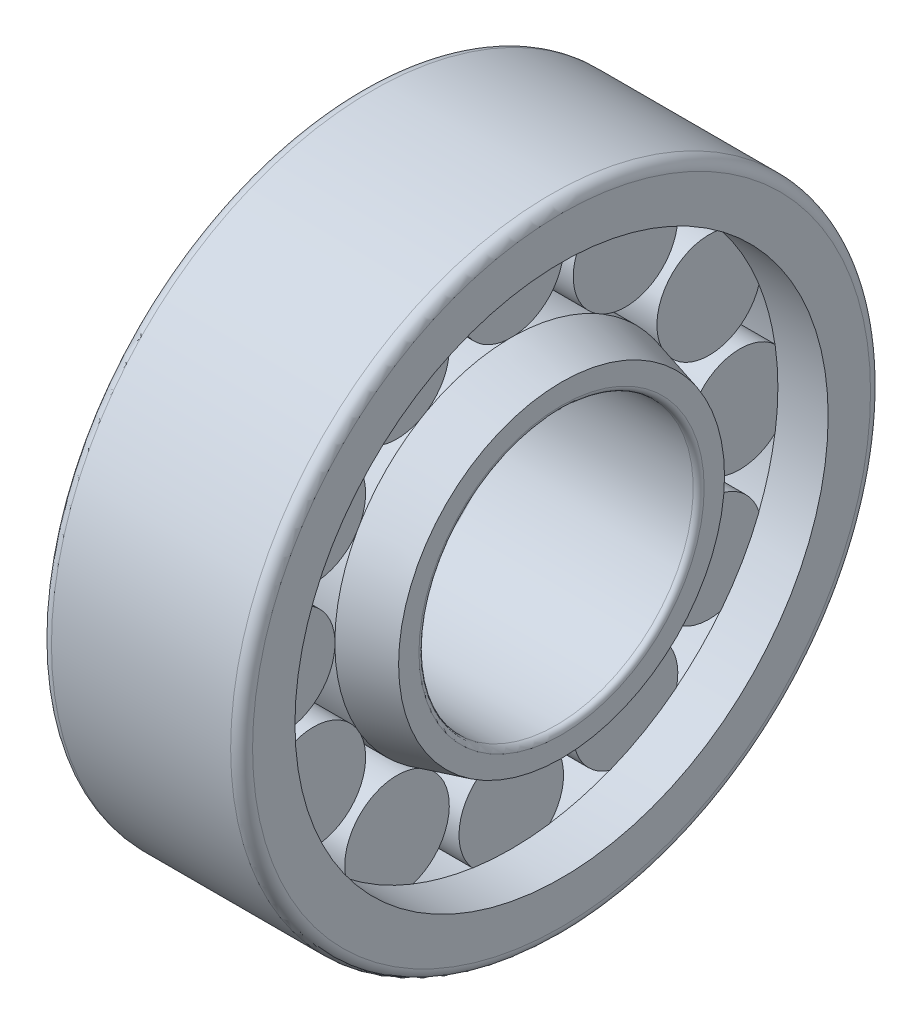
from build123d import *

# Parameters (mm, degrees)
SKETCH2_W               = 5.5
SKETCH2_H               = 2.86
CIRCULAR_PATTERN1_COUNT = 12
FILLET1_R               = 0.6
FILLET2_R               = 0.3


with BuildPart() as part:
    # Sketch1 → Revolve1 (revolve)
    with BuildSketch(Plane.XY):
        Polygon((-5.5, 7.5), (5.5, 7.5), (5.5, 8.913139721), (2.75, 9.65), (-2.75, 9.65), (-5.5, 8.913139721), align=None)
    revolve(axis=Axis((-10.137871204, 0, 0), (1, 0, 0)))

    # Sketch2 → Revolve2 (revolve)
    with BuildSketch(Plane.XY):
        with Locations((0, 11.07)):
            Rectangle(SKETCH2_W, SKETCH2_H)
    revolve2 = revolve(axis=Axis((-7.422783257, 12.5, 0), (1, 0, 0)))

    # Sketch3 → Revolve3 (revolve)
    with BuildSketch(Plane.XY):
        Polygon((-5.5, 17.5), (5.5, 17.5), (5.5, 14.5825), (2.74, 14.5825), (2.74, 15.35), (-2.74, 15.35), (-2.74, 14.5825), (-5.5, 14.5825), align=None)
    revolve(axis=Axis((-9.082213196, 0, 0), (1, 0, 0)))

    # Circular-Pattern1: Revolve2 ×12 about axis
    circular_pattern1_axis = Axis((-10.137871204, 0, 0), (1, 0, 0))
    for i in range(1, CIRCULAR_PATTERN1_COUNT):
        add(revolve2.rotate(circular_pattern1_axis, i * 360 / CIRCULAR_PATTERN1_COUNT))

    # Fillet1
    fillet1_edges = [part.edges().sort_by_distance(p)[0] for p in [
        (-5.5, -17.5, 0),
        (5.5, -17.5, 0),
    ]]
    fillet(fillet1_edges, radius=FILLET1_R)

    # Fillet2
    fillet2_edges = [part.edges().sort_by_distance(p)[0] for p in [
        (5.5, -7.5, 0),
        (-5.5, -7.5, 0),
    ]]
    fillet(fillet2_edges, radius=FILLET2_R)


solid = part.part
